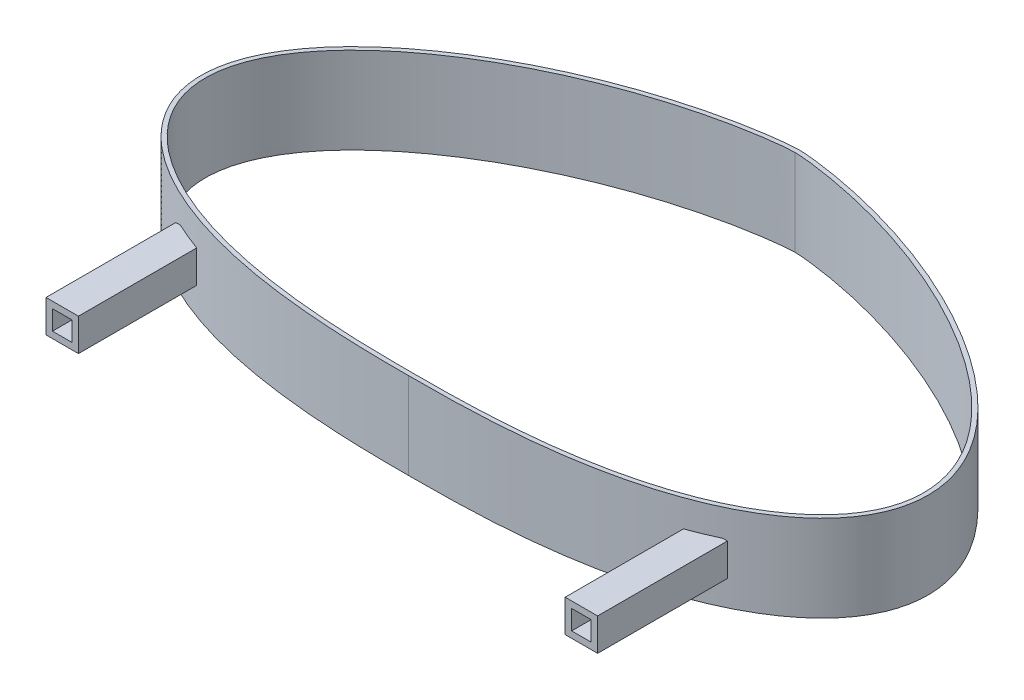
from build123d import *

# Parameters (mm, degrees)
EXTRUDE_1_DEPTH      = 40
EXTRUDE_2_DEPTH      = 40
EXTRUDE_2_DEPTH_BACK = 20
SKETCH_4_W           = 15
SKETCH_4_H           = 15
SKETCH_4_W_2         = 9
SKETCH_4_H_2         = 9


# Read off the part's stored shape, not the designer's step: 凸台-拉伸1
with BuildPart() as part:
    # 凸台-拉伸1 outline → 凸台-拉伸1 (new body)
    with BuildSketch(Plane(origin=(0, 0, 0), x_dir=(1, 0, 0), z_dir=(0, 1, 0))):
        with BuildLine():
            add(Edge.make_bspline(
                [(0, -88.941340782), (0.143694254, -88.941340782), (0.407728148, -88.941342586), (1.122632852, -88.94131402), (2.224799714, -88.941048741), (3.891043306, -88.939234912), (6.517312943, -88.932431922), (10.496036597, -88.910216132), (16.182253211, -88.839045812), (22.606226813, -88.696789161), (31.951272315, -88.375217471), (44.748686071, -87.655400442), (60.984877351, -86.081351278), (77.394179622, -83.6452623), (93.411824158, -80.253196467), (113.650717406, -74.40823977), (135.916384238, -64.632547393), (155.681921715, -49.402177692), (167.151961913, -31.288799023), (169.263776207, -11.192796805), (161.947847767, 9.443106221), (146.15740587, 29.645701261), (123.242516382, 48.526063014), (99.895835354, 62.222239996), (80.073543624, 71.413624181), (65.059489325, 77.323220917), (50.34937982, 82.180859278), (36.431267567, 85.968286754), (25.922927638, 88.262796319), (18.443017834, 89.626582428), (13.367711849, 90.42912116), (8.899774617, 91.027754855), (5.744484293, 91.3708812), (3.598079058, 91.559732799), (2.18398535, 91.660152083), (1.178431511, 91.710563688), (0.467899732, 91.731094254), (0.159916257, 91.734636872), (-0.159916257, 91.734636872), (-0.467899732, 91.731094254), (-1.178431511, 91.710563688), (-2.18398535, 91.660152083), (-3.598079058, 91.559732799), (-5.744484293, 91.3708812), (-8.899774617, 91.027754855), (-13.367711849, 90.42912116), (-18.443017834, 89.626582428), (-25.922927638, 88.262796319), (-36.431267567, 85.968286754), (-50.34937982, 82.180859278), (-65.059489325, 77.323220917), (-80.073543624, 71.413624181), (-99.895835354, 62.222239996), (-123.242516382, 48.526063014), (-146.15740587, 29.645701261), (-161.947847767, 9.443106221), (-169.263776207, -11.192796805), (-167.151961913, -31.288799023), (-155.681921715, -49.402177692), (-135.916384238, -64.632547393), (-113.650717406, -74.40823977), (-93.411824158, -80.253196467), (-77.394179622, -83.6452623), (-60.984877351, -86.081351278), (-44.748686071, -87.655400442), (-31.951272315, -88.375217471), (-22.606226813, -88.696789161), (-16.182253211, -88.839045812), (-10.496036597, -88.910216132), (-6.517312943, -88.932431922), (-3.891043306, -88.939234912), (-2.224799714, -88.941048741), (-1.122632852, -88.94131402), (-0.407728148, -88.941342586), (-0.143694254, -88.941340782), (0, -88.941340782)],
                knots=[0, 0, 0, 0, 0.00390625, 0.0078125, 0.015625, 0.0234375, 0.03125, 0.046875, 0.0625, 0.078125, 0.09375, 0.125, 0.15625, 0.1875, 0.21875, 0.25, 0.3125, 0.375, 0.4375, 0.5, 0.5625, 0.625, 0.6875, 0.75, 0.78125, 0.8125, 0.84375, 0.875, 0.90625, 0.921875, 0.9375, 0.953125, 0.96875, 0.9765625, 0.984375, 0.9921875, 0.99609375, 1, 1, 1.00390625, 1.0078125, 1.015625, 1.0234375, 1.03125, 1.046875, 1.0625, 1.078125, 1.09375, 1.125, 1.15625, 1.1875, 1.21875, 1.25, 1.3125, 1.375, 1.4375, 1.5, 1.5625, 1.625, 1.6875, 1.75, 1.78125, 1.8125, 1.84375, 1.875, 1.90625, 1.921875, 1.9375, 1.953125, 1.96875, 1.9765625, 1.984375, 1.9921875, 1.99609375, 2, 2, 2, 2], degree=3))
        make_face()
        with BuildLine():
            add(Edge.make_bspline(
                [(0, -86.941340782), (-9.776536313, -86.941340782), (-92.17877095, -86.941340782), (-145.94972067, -86.941340782), (-195.530726257, -40.851955307), (-195.530726257, -15.01396648), (-188.547486034, 15.01396648), (-125, 68.086592179), (-64.245810056, 82.751396648), (-10.474860335, 89.734636872), (10.474860335, 89.734636872), (64.245810056, 82.751396648), (125, 68.086592179), (188.547486034, 15.01396648), (195.530726257, -15.01396648), (195.530726257, -40.851955307), (145.94972067, -86.941340782), (92.17877095, -86.941340782), (9.776536313, -86.941340782), (0, -86.941340782)],
                knots=[0, 0, 0, 0, 0, 0, 0, 0, 0, 0, 0, 1, 1, 1, 1, 1, 1, 1, 1, 1, 2, 2, 2, 2, 2, 2, 2, 2, 2, 2, 2], degree=10))
        make_face(mode=Mode.SUBTRACT)
    extrude(amount=EXTRUDE_1_DEPTH)

    # 草图4 → 凸台-拉伸2 (add, two sides: drawn at the far end of the back side and taken through both)
    # profile 1 of 2: a face of its own
    with BuildSketch(Plane.XY.offset(88.941340782).offset(-EXTRUDE_2_DEPTH_BACK)):
        with Locations((120, 20)):
            Rectangle(SKETCH_4_W, SKETCH_4_H)
        with Locations((120, 20)):
            Rectangle(SKETCH_4_W_2, SKETCH_4_H_2, mode=Mode.SUBTRACT)
    # profile 2 of 2: a face of its own
    with BuildSketch(Plane.XY.offset(88.941340782).offset(-EXTRUDE_2_DEPTH_BACK)):
        with Locations((-120, 20)):
            Rectangle(SKETCH_4_W, SKETCH_4_H)
        with Locations((-120, 20)):
            Rectangle(SKETCH_4_W_2, SKETCH_4_H_2, mode=Mode.SUBTRACT)
    extrude(amount=EXTRUDE_2_DEPTH + EXTRUDE_2_DEPTH_BACK)


solid = part.part
